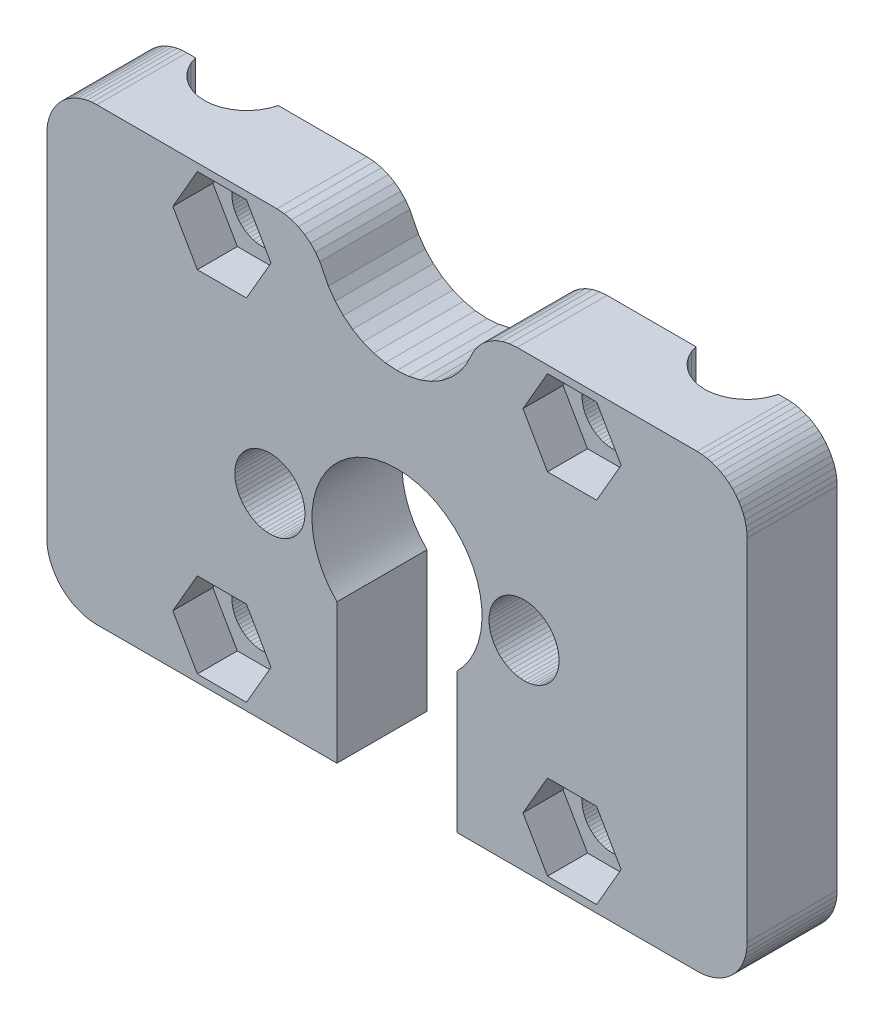
from build123d import *

# Parameters (mm, degrees)
BOSS_EXTRUDE1_DEPTH = 9
CUT_EXTRUDE1_DEPTH  = 84.701851831
CUT_EXTRUDE2_DEPTH  = 84.701851831
CUT_EXTRUDE3_DEPTH  = 84.701851831
CUT_EXTRUDE4_DEPTH  = 4
CUT_EXTRUDE5_DEPTH  = 84.701851831
CUT_EXTRUDE6_DEPTH  = 4
CUT_EXTRUDE7_DEPTH  = 84.701851831
CUT_EXTRUDE8_DEPTH  = 4
CUT_EXTRUDE9_DEPTH  = 84.701851831
CUT_EXTRUDE10_DEPTH = 4
CUT_EXTRUDE11_DEPTH = 84.701851831
CUT_EXTRUDE12_DEPTH = 84.701851831
CUT_EXTRUDE13_DEPTH = 84.701851831
DRAFT1_ANGLE        = 18.383414166
DRAFT2_ANGLE        = 18.383260461
DRAFT3_ANGLE        = 18.383260461
SKETCH15_R          = 8.5
CUT_EXTRUDE14_DEPTH = 84.701851831


with BuildPart() as part:
    # Sketch1 → Boss-Extrude1 (new body)
    with BuildSketch(Plane.XY.offset(9)):
        Polygon((5, 0), (65, 0), (65.49009, 0.02407637), (65.97545, 0.0960736), (66.45142, 0.2152983), (66.91342, 0.3806023), (67.35698, 0.5903937), (67.77785, 0.8426519), (68.17197, 1.134948), (68.53553, 1.464466), (68.86505, 1.828034), (69.15735, 2.222149), (69.40961, 2.643016), (69.6194, 3.086583), (69.7847, 3.548577), (69.90393, 4.024548), (69.97592, 4.509914), (70, 5), (70, 40), (69.97592, 40.49009), (69.90393, 40.97545), (69.7847, 41.45142), (69.6194, 41.91342), (69.40961, 42.35698), (69.15735, 42.77785), (68.86505, 43.17197), (68.53553, 43.53553), (68.17197, 43.86505), (67.77785, 44.15735), (67.35698, 44.40961), (66.91342, 44.6194), (66.45142, 44.7847), (65.97545, 44.90393), (65.49009, 44.97592), (65, 45), (47, 45), (46.267658046, 44.946002735), (45.551097088, 44.785397012), (44.865785513, 44.521561104), (44.226513355, 44.16019492), (43.647060662, 43.709088379), (43.139937492, 43.177981406), (42.716073912, 42.578313937), (42.38462, 41.923035915), (41.85428687, 40.874577498), (41.176104007, 39.915119523), (40.36471147, 39.065331945), (39.437589316, 38.343564712), (38.41475759, 37.765367765), (37.31825633, 37.343231038), (36.171755563, 37.08625446), (34.999985305, 36.999977958), (33.828215563, 37.086261455), (32.68171633, 37.343244878), (31.58521759, 37.76538815), (30.562389316, 38.343591203), (29.63527147, 39.065363971), (28.823884007, 39.915156393), (28.14570687, 40.874618417), (27.61538, 41.92308), (27.28393, 42.57836), (26.86007, 43.17803), (26.35295, 43.70914), (25.7735, 44.16025), (25.13423, 44.52162), (24.44892, 44.78546), (23.73236, 44.94607), (23, 45), (5, 45), (4.509914, 44.97592), (4.024548, 44.90393), (3.548577, 44.7847), (3.086583, 44.6194), (2.643016, 44.40961), (2.222149, 44.15735), (1.828034, 43.86505), (1.464466, 43.53553), (1.134948, 43.17197), (0.8426519, 42.77785), (0.5903937, 42.35698), (0.3806023, 41.91342), (0.2152983, 41.45142), (0.0960736, 40.97545), (0.02407637, 40.49009), (0, 40), (0, 5), (0.02407637, 4.509914), (0.0960736, 4.024548), (0.2152983, 3.548577), (0.3806023, 3.086583), (0.5903937, 2.643016), (0.8426519, 2.222149), (1.134948, 1.828034), (1.464466, 1.464466), (1.828034, 1.134948), (2.222149, 0.8426519), (2.643016, 0.5903937), (3.086583, 0.3806023), (3.548577, 0.2152983), (4.024548, 0.0960736), (4.509914, 0.02407637), align=None)
    extrude(amount=-BOSS_EXTRUDE1_DEPTH)

    # Sketch2 → Cut-Extrude1 (cut, through all)
    with BuildSketch(Plane(origin=(0, 45, 0), x_dir=(-1, 0, 0), z_dir=(0, 1, 0))):
        Polygon((-64.13068, 0), (-55.86932, 0), (-55.86932, 0.250558199), (-56.42385, 1.296441), (-56.85435, 1.857866), (-57.37203, 2.340097), (-57.96252, 2.72977), (-58.60948, 3.016087), (-59.29497, 3.191114), (-60, 3.25), (-60.70503, 3.191114), (-61.39052, 3.016087), (-62.03748, 2.72977), (-62.62797, 2.340097), (-63.14565, 1.857866), (-63.57615, 1.296441), (-64.13068, 0.250558199), align=None)
    extrude(amount=-CUT_EXTRUDE1_DEPTH, mode=Mode.SUBTRACT)

    # Sketch3 → Cut-Extrude2 (cut, through all)
    with BuildSketch(Plane(origin=(0, 45, 0), x_dir=(-1, 0, 0), z_dir=(0, 1, 0))):
        Polygon((-14.13068, 0), (-5.869322, 0), (-5.869322, 0.250548078), (-6.423849, 1.296441), (-6.854352, 1.857866), (-7.372025, 2.340097), (-7.962523, 2.72977), (-8.609481, 3.016087), (-9.294972, 3.191114), (-10, 3.25), (-10.70503, 3.191114), (-11.39052, 3.016087), (-12.03748, 2.72977), (-12.62797, 2.340097), (-13.14565, 1.857866), (-13.57615, 1.296441), (-14.13068, 0.250558199), align=None)
    extrude(amount=-CUT_EXTRUDE2_DEPTH, mode=Mode.SUBTRACT)

    # Sketch4 → Cut-Extrude3 (cut, through all)
    with BuildSketch(Plane(origin=(0, 0, 0), x_dir=(-1, 0, 0), z_dir=(0, 0, -1))):
        Polygon((-41, 0), (-29, 0), (-29, 20), (-29.02889, 20.5881), (-29.11529, 21.17054), (-29.25836, 21.74171), (-29.45672, 22.2961), (-29.70847, 22.82838), (-30.01118, 23.33342), (-30.36194, 23.80636), (-30.75736, 24.24264), (-31.19364, 24.63806), (-31.66658, 24.98882), (-32.17162, 25.29153), (-32.7039, 25.54328), (-33.25829, 25.74164), (-33.82946, 25.88471), (-34.4119, 25.97111), (-35, 26), (-35.5881, 25.97111), (-36.17054, 25.88471), (-36.74171, 25.74164), (-37.2961, 25.54328), (-37.82838, 25.29153), (-38.33342, 24.98882), (-38.80636, 24.63806), (-39.24264, 24.24264), (-39.63806, 23.80636), (-39.98882, 23.33342), (-40.29153, 22.82838), (-40.54328, 22.2961), (-40.74164, 21.74171), (-40.88471, 21.17054), (-40.97111, 20.5881), (-41, 20), align=None)
    extrude(amount=-CUT_EXTRUDE3_DEPTH, mode=Mode.SUBTRACT)

    # Sketch5 → Cut-Extrude4 (cut)
    with BuildSketch(Plane.XY.offset(9)):
        Polygon((54.95374, 9.25), (50.04626, 9.25), (47.59252, 5), (50.04626, 0.75), (54.95374, 0.75), (57.40748, 5), align=None)
    extrude(amount=-CUT_EXTRUDE4_DEPTH, mode=Mode.SUBTRACT)

    # Sketch6 → Cut-Extrude5 (cut, through all)
    with BuildSketch(Plane(origin=(0, 0, 0), x_dir=(-1, 0, 0), z_dir=(0, 0, -1))):
        Polygon((-49.5, 5), (-49.51445, 5.294051), (-49.55764, 5.585271), (-49.62918, 5.870854), (-49.72836, 6.14805), (-49.85424, 6.41419), (-50.00559, 6.666711), (-50.18097, 6.90318), (-50.37868, 7.12132), (-50.59682, 7.319031), (-50.83329, 7.494409), (-51.08581, 7.645764), (-51.35195, 7.771639), (-51.62915, 7.870821), (-51.91473, 7.942356), (-52.20595, 7.985554), (-52.5, 8), (-52.79405, 7.985554), (-53.08527, 7.942356), (-53.37085, 7.870821), (-53.64805, 7.771639), (-53.91419, 7.645764), (-54.16671, 7.494409), (-54.40318, 7.319031), (-54.62132, 7.12132), (-54.81903, 6.90318), (-54.99441, 6.666711), (-55.14576, 6.41419), (-55.27164, 6.14805), (-55.37082, 5.870854), (-55.44236, 5.585271), (-55.48555, 5.294051), (-55.5, 5), (-55.48555, 4.705949), (-55.44236, 4.414729), (-55.37082, 4.129146), (-55.27164, 3.85195), (-55.14576, 3.58581), (-54.99441, 3.333289), (-54.81903, 3.09682), (-54.62132, 2.87868), (-54.40318, 2.680969), (-54.16671, 2.505591), (-53.91419, 2.354236), (-53.64805, 2.228361), (-53.37085, 2.129179), (-53.08527, 2.057644), (-52.79405, 2.014446), (-52.5, 2), (-52.20595, 2.014446), (-51.91473, 2.057644), (-51.62915, 2.129179), (-51.35195, 2.228361), (-51.08581, 2.354236), (-50.83329, 2.505591), (-50.59682, 2.680969), (-50.37868, 2.87868), (-50.18097, 3.09682), (-50.00559, 3.333289), (-49.85424, 3.58581), (-49.72836, 3.85195), (-49.62918, 4.129146), (-49.55764, 4.414729), (-49.51445, 4.705949), align=None)
    extrude(amount=-CUT_EXTRUDE5_DEPTH, mode=Mode.SUBTRACT)

    # Sketch7 → Cut-Extrude6 (cut)
    with BuildSketch(Plane.XY.offset(9)):
        Polygon((50.04626, 35.75), (54.95374, 35.75), (57.40748, 40), (54.95374, 44.25), (50.04626, 44.25), (47.59252, 40), align=None)
    extrude(amount=-CUT_EXTRUDE6_DEPTH, mode=Mode.SUBTRACT)

    # Sketch8 → Cut-Extrude7 (cut, through all)
    with BuildSketch(Plane(origin=(0, 0, 0), x_dir=(-1, 0, 0), z_dir=(0, 0, -1))):
        Polygon((-55.5, 40), (-55.48555, 39.70595), (-55.44236, 39.41473), (-55.37082, 39.12915), (-55.27164, 38.85195), (-55.14576, 38.58581), (-54.99441, 38.33329), (-54.81903, 38.09682), (-54.62132, 37.87868), (-54.40318, 37.68097), (-54.16671, 37.50559), (-53.91419, 37.35424), (-53.64805, 37.22836), (-53.37085, 37.12918), (-53.08527, 37.05764), (-52.79405, 37.01445), (-52.5, 37), (-52.20595, 37.01445), (-51.91473, 37.05764), (-51.62915, 37.12918), (-51.35195, 37.22836), (-51.08581, 37.35424), (-50.83329, 37.50559), (-50.59682, 37.68097), (-50.37868, 37.87868), (-50.18097, 38.09682), (-50.00559, 38.33329), (-49.85424, 38.58581), (-49.72836, 38.85195), (-49.62918, 39.12915), (-49.55764, 39.41473), (-49.51445, 39.70595), (-49.5, 40), (-49.51445, 40.29405), (-49.55764, 40.58527), (-49.62918, 40.87085), (-49.72836, 41.14805), (-49.85424, 41.41419), (-50.00559, 41.66671), (-50.18097, 41.90318), (-50.37868, 42.12132), (-50.59682, 42.31903), (-50.83329, 42.49441), (-51.08581, 42.64576), (-51.35195, 42.77164), (-51.62915, 42.87082), (-51.91473, 42.94236), (-52.20595, 42.98555), (-52.5, 43), (-52.79405, 42.98555), (-53.08527, 42.94236), (-53.37085, 42.87082), (-53.64805, 42.77164), (-53.91419, 42.64576), (-54.16671, 42.49441), (-54.40318, 42.31903), (-54.62132, 42.12132), (-54.81903, 41.90318), (-54.99441, 41.66671), (-55.14576, 41.41419), (-55.27164, 41.14805), (-55.37082, 40.87085), (-55.44236, 40.58527), (-55.48555, 40.29405), align=None)
    extrude(amount=-CUT_EXTRUDE7_DEPTH, mode=Mode.SUBTRACT)

    # Sketch9 → Cut-Extrude8 (cut)
    with BuildSketch(Plane.XY.offset(9)):
        Polygon((12.59252, 40), (15.04626, 35.75), (19.95374, 35.75), (22.40748, 40), (19.95374, 44.25), (15.04626, 44.25), align=None)
    extrude(amount=-CUT_EXTRUDE8_DEPTH, mode=Mode.SUBTRACT)

    # Sketch10 → Cut-Extrude9 (cut, through all)
    with BuildSketch(Plane(origin=(0, 0, 0), x_dir=(-1, 0, 0), z_dir=(0, 0, -1))):
        Polygon((-17.20595, 37.01445), (-16.91473, 37.05764), (-16.62915, 37.12918), (-16.35195, 37.22836), (-16.08581, 37.35424), (-15.83329, 37.50559), (-15.59682, 37.68097), (-15.37868, 37.87868), (-15.18097, 38.09682), (-15.00559, 38.33329), (-14.85424, 38.58581), (-14.72836, 38.85195), (-14.62918, 39.12915), (-14.55764, 39.41473), (-14.51445, 39.70595), (-14.5, 40), (-14.51445, 40.29405), (-14.55764, 40.58527), (-14.62918, 40.87085), (-14.72836, 41.14805), (-14.85424, 41.41419), (-15.00559, 41.66671), (-15.18097, 41.90318), (-15.37868, 42.12132), (-15.59682, 42.31903), (-15.83329, 42.49441), (-16.08581, 42.64576), (-16.35195, 42.77164), (-16.62915, 42.87082), (-16.91473, 42.94236), (-17.20595, 42.98555), (-17.5, 43), (-17.79405, 42.98555), (-18.08527, 42.94236), (-18.37085, 42.87082), (-18.64805, 42.77164), (-18.91419, 42.64576), (-19.16671, 42.49441), (-19.40318, 42.31903), (-19.62132, 42.12132), (-19.81903, 41.90318), (-19.99441, 41.66671), (-20.14576, 41.41419), (-20.27164, 41.14805), (-20.37082, 40.87085), (-20.44236, 40.58527), (-20.48555, 40.29405), (-20.5, 40), (-20.48555, 39.70595), (-20.44236, 39.41473), (-20.37082, 39.12915), (-20.27164, 38.85195), (-20.14576, 38.58581), (-19.99441, 38.33329), (-19.81903, 38.09682), (-19.62132, 37.87868), (-19.40318, 37.68097), (-19.16671, 37.50559), (-18.91419, 37.35424), (-18.64805, 37.22836), (-18.37085, 37.12918), (-18.08527, 37.05764), (-17.79405, 37.01445), (-17.5, 37), align=None)
    extrude(amount=-CUT_EXTRUDE9_DEPTH, mode=Mode.SUBTRACT)

    # Sketch11 → Cut-Extrude10 (cut)
    with BuildSketch(Plane.XY.offset(9)):
        Polygon((22.40748, 5), (19.95374, 9.25), (15.04626, 9.25), (12.59252, 5), (15.04626, 0.75), (19.95374, 0.75), align=None)
    extrude(amount=-CUT_EXTRUDE10_DEPTH, mode=Mode.SUBTRACT)

    # Sketch12 → Cut-Extrude11 (cut, through all)
    with BuildSketch(Plane(origin=(0, 0, 0), x_dir=(-1, 0, 0), z_dir=(0, 0, -1))):
        Polygon((-14.85424, 6.41419), (-15.00559, 6.666711), (-15.18097, 6.90318), (-15.37868, 7.12132), (-15.59682, 7.319031), (-15.83329, 7.494409), (-16.08581, 7.645764), (-16.35195, 7.771639), (-16.62915, 7.870821), (-16.91473, 7.942356), (-17.20595, 7.985554), (-17.5, 8), (-17.79405, 7.985554), (-18.08527, 7.942356), (-18.37085, 7.870821), (-18.64805, 7.771639), (-18.91419, 7.645764), (-19.16671, 7.494409), (-19.40318, 7.319031), (-19.62132, 7.12132), (-19.81903, 6.90318), (-19.99441, 6.666711), (-20.14576, 6.41419), (-20.27164, 6.14805), (-20.37082, 5.870854), (-20.44236, 5.585271), (-20.48555, 5.294051), (-20.5, 5), (-20.48555, 4.705949), (-20.44236, 4.414729), (-20.37082, 4.129146), (-20.27164, 3.85195), (-20.14576, 3.58581), (-19.99441, 3.333289), (-19.81903, 3.09682), (-19.62132, 2.87868), (-19.40318, 2.680969), (-19.16671, 2.505591), (-18.91419, 2.354236), (-18.64805, 2.228361), (-18.37085, 2.129179), (-18.08527, 2.057644), (-17.79405, 2.014446), (-17.5, 2), (-17.20595, 2.014446), (-16.91473, 2.057644), (-16.62915, 2.129179), (-16.35195, 2.228361), (-16.08581, 2.354236), (-15.83329, 2.505591), (-15.59682, 2.680969), (-15.37868, 2.87868), (-15.18097, 3.09682), (-15.00559, 3.333289), (-14.85424, 3.58581), (-14.72836, 3.85195), (-14.62918, 4.129146), (-14.55764, 4.414729), (-14.51445, 4.705949), (-14.5, 5), (-14.51445, 5.294051), (-14.55764, 5.585271), (-14.62918, 5.870854), (-14.72836, 6.14805), align=None)
    extrude(amount=-CUT_EXTRUDE11_DEPTH, mode=Mode.SUBTRACT)

    # Sketch13 → Cut-Extrude12 (cut, through all)
    with BuildSketch(Plane.XY.offset(9)):
        Polygon((22.3, 23.5), (21.95694, 23.48315), (21.61718, 23.43275), (21.284, 23.34929), (20.96061, 23.23358), (20.65011, 23.08672), (20.3555, 22.91014), (20.07962, 22.70554), (19.82513, 22.47487), (19.59446, 22.22038), (19.38986, 21.9445), (19.21328, 21.64989), (19.06642, 21.33939), (18.95071, 21.016), (18.86725, 20.68282), (18.81685, 20.34306), (18.8, 20), (18.81685, 19.65694), (18.86725, 19.31718), (18.95071, 18.984), (19.06642, 18.66061), (19.21328, 18.35011), (19.38986, 18.0555), (19.59446, 17.77962), (19.82513, 17.52513), (20.07962, 17.29446), (20.3555, 17.08986), (20.65011, 16.91328), (20.96061, 16.76642), (21.284, 16.65071), (21.61718, 16.56725), (21.95694, 16.51685), (22.3, 16.5), (22.64306, 16.51685), (22.98282, 16.56725), (23.316, 16.65071), (23.63939, 16.76642), (23.94989, 16.91328), (24.2445, 17.08986), (24.52038, 17.29446), (24.77487, 17.52513), (25.00554, 17.77962), (25.21014, 18.0555), (25.38672, 18.35011), (25.53358, 18.66061), (25.64929, 18.984), (25.73275, 19.31718), (25.78315, 19.65694), (25.8, 20), (25.78315, 20.34306), (25.73275, 20.68282), (25.64929, 21.016), (25.53358, 21.33939), (25.38672, 21.64989), (25.21014, 21.9445), (25.00554, 22.22038), (24.77487, 22.47487), (24.52038, 22.70554), (24.2445, 22.91014), (23.94989, 23.08672), (23.63939, 23.23358), (23.316, 23.34929), (22.98282, 23.43275), (22.64306, 23.48315), align=None)
    extrude(amount=-CUT_EXTRUDE12_DEPTH, mode=Mode.SUBTRACT)

    # Sketch14 → Cut-Extrude13 (cut, through all)
    with BuildSketch(Plane(origin=(0, 0, 0), x_dir=(-1, 0, 0), z_dir=(0, 0, -1))):
        Polygon((-47.35694, 16.51685), (-47.01718, 16.56725), (-46.684, 16.65071), (-46.36061, 16.76642), (-46.05011, 16.91328), (-45.7555, 17.08986), (-45.47962, 17.29446), (-45.22513, 17.52513), (-44.99446, 17.77962), (-44.78986, 18.0555), (-44.61328, 18.35011), (-44.46642, 18.66061), (-44.35071, 18.984), (-44.26725, 19.31718), (-44.21685, 19.65694), (-44.2, 20), (-44.21685, 20.34306), (-44.26725, 20.68282), (-44.35071, 21.016), (-44.46642, 21.33939), (-44.61328, 21.64989), (-44.78986, 21.9445), (-44.99446, 22.22038), (-45.22513, 22.47487), (-45.47962, 22.70554), (-45.7555, 22.91014), (-46.05011, 23.08672), (-46.36061, 23.23358), (-46.684, 23.34929), (-47.01718, 23.43275), (-47.35694, 23.48315), (-47.7, 23.5), (-48.04306, 23.48315), (-48.38282, 23.43275), (-48.716, 23.34929), (-49.03939, 23.23358), (-49.34989, 23.08672), (-49.6445, 22.91014), (-49.92038, 22.70554), (-50.17487, 22.47487), (-50.40554, 22.22038), (-50.61014, 21.9445), (-50.78672, 21.64989), (-50.93358, 21.33939), (-51.04929, 21.016), (-51.13275, 20.68282), (-51.18315, 20.34306), (-51.2, 20), (-51.18315, 19.65694), (-51.13275, 19.31718), (-51.04929, 18.984), (-50.93358, 18.66061), (-50.78672, 18.35011), (-50.61014, 18.0555), (-50.40554, 17.77962), (-50.17487, 17.52513), (-49.92038, 17.29446), (-49.6445, 17.08986), (-49.34989, 16.91328), (-49.03939, 16.76642), (-48.716, 16.65071), (-48.38282, 16.56725), (-48.04306, 16.51685), (-47.7, 16.5), align=None)
    extrude(amount=-CUT_EXTRUDE13_DEPTH, mode=Mode.SUBTRACT)

    # Draft1
    draft1_faces = [part.faces().sort_by_distance(p)[0] for p in [
        (5.869322, 22.5, 0.125274039),
    ]]
    draft(draft1_faces, Plane(origin=(-1.948287856, 0.341347333, 0), x_dir=(-1, 0, 0), z_dir=(0, 0, -1)), DRAFT1_ANGLE)

    # Draft2
    draft2_faces = [part.faces().sort_by_distance(p)[0] for p in [
        (64.13068, 22.5, 0.1252791),
    ]]
    draft(draft2_faces, Plane(origin=(-1.948287856, 0.341347333, 0), x_dir=(-1, 0, 0), z_dir=(0, 0, -1)), DRAFT2_ANGLE)

    # Draft3
    draft3_faces = [part.faces().sort_by_distance(p)[0] for p in [
        (55.86932, 22.5, 0.1252791),
        (14.13068, 22.5, 0.1252791),
    ]]
    draft(draft3_faces, Plane(origin=(-1.948287856, 0.341347333, 0), x_dir=(-1, 0, 0), z_dir=(0, 0, -1)), DRAFT3_ANGLE)

    # Sketch15 → Cut-Extrude14 (cut, through all)
    with BuildSketch(Plane.XY.offset(9)):
        with Locations((35, 20)):
            Circle(SKETCH15_R)
    extrude(amount=-CUT_EXTRUDE14_DEPTH, mode=Mode.SUBTRACT)


solid = part.part
